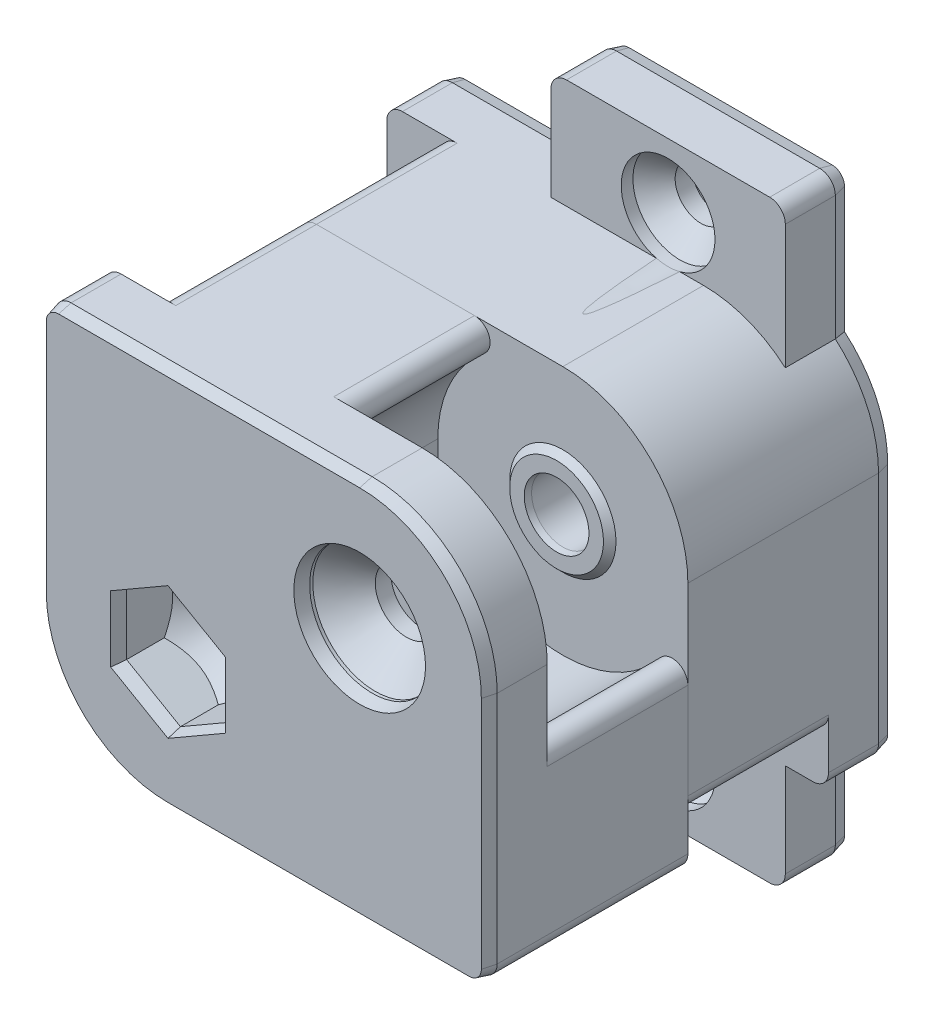
from build123d import *
from OCP.BRepFilletAPI import BRepFilletAPI_MakeChamfer

# Parameters (mm, degrees)
SKETCH1_R              = 2
EXTRUDE1_DEPTH         = 4
EXTRUDE2_START         = 4
EXTRUDE2_OUTLINE_R     = 2
EXTRUDE2_DEPTH         = 9
SKETCH2_W              = 3.5
SKETCH2_H              = 16
SKETCH2_W_2            = 12.265
SKETCH2_H_2            = 3.205245732
SKETCH2_W_3            = 8
SKETCH2_H_3            = 4.794754268
EXTRUDE3_DEPTH         = 9
SKETCH5_R              = 2
SKETCH5_W              = 12.265
SKETCH5_H              = 3.205245732
EXTRUDE4_DEPTH         = 9
SKETCH6_R              = 2
EXTRUDE5_DEPTH         = 4
FILLET1_START          = 12
FILLET1_DEPTH          = 10
FILLET1_START_2        = 21.15058
FILLET1_2_DEPTH        = 5.84942
FILLET2_R              = 1
SKETCH7_R              = 1.65
SKETCH7_W              = 15
SKETCH7_H              = 6.99475429
EXTRUDE6_DEPTH         = 4
SKETCH8_R              = 3
EXTRUDE7_DEPTH         = 14
EXTRUDE7_TAPER         = 1
SKETCH12_R             = 4
EXTRUDE15_DEPTH        = 1
SKETCH13_R             = 3
EXTRUDE16_DEPTH        = 0.6
SKETCH14_R             = 4.000000009
EXTRUDE17_DEPTH        = 1
CHAMFER1_START         = 3.25
CHAMFER1_2_OUTLINE_R   = 3
CHAMFER1_2_OUTLINE_R_2 = 1.65
CHAMFER1_2_DEPTH       = 0.15
CHAMFER7_SIZE          = 2
CHAMFER2_SIZE          = 2
SKETCH9_R              = 2
EXTRUDE8_DEPTH         = 3.2
EXTRUDE9_START         = -26
EXTRUDE9_DEPTH         = 3.2
CHAMFER4_START         = 3.2
CHAMFER4_2_OUTLINE_R   = 2
CHAMFER4_2_DEPTH       = 0.016283143
CHAMFER4_START_2       = 3.216283143
CHAMFER4_3_OUTLINE_W   = 11
CHAMFER4_3_OUTLINE_H   = 10
CHAMFER4_3_DEPTH       = 0.533716265
SKETCH10_R             = 2
EXTRUDE10_DEPTH        = 3
EXTRUDE10_TAPER        = 5
SKETCH_2_R             = 2
EXTRUDE11_DEPTH        = 3
EXTRUDE11_DRAFT        = -5
SKETCH_3_R             = 2
EXTRUDE13_DEPTH        = 3.2
EXTRUDE13_DRAFT        = -3
SKETCH_4_R             = 2
EXTRUDE14_DEPTH        = 3.2
EXTRUDE14_TAPER        = 3
FILLET3_R              = 1
CHAMFER5_SIZE          = 0.8
CHAMFER5_SIZE2         = 0.214359354
CHAMFER6_SIZE          = 0.8
CHAMFER6_SIZE2         = 0.214359354
SKETCH15_R             = 3
SKETCH15_R_2           = 2
EXTRUDE18_DEPTH        = 0.4
EXTRUDE18_DRAFT        = 10
SKETCH16_R             = 3
SKETCH16_R_2           = 2
EXTRUDE19_DEPTH        = 0.4
EXTRUDE19_DRAFT        = 10
SKETCH17_R             = 3
SKETCH17_R_2           = 2
EXTRUDE20_DEPTH        = 0.4
EXTRUDE20_DRAFT        = 10
SKETCH18_R             = 3
SKETCH18_R_2           = 2
EXTRUDE21_DEPTH        = 0.4
EXTRUDE21_DRAFT        = 10
CHAMFER9_SIZE          = 0.4
CHAMFER9_SIZE_2        = 0.493121221


with BuildPart() as part:
    # Sketch1 → Extrude1 (new body)
    with BuildSketch(Plane.XY):
        with BuildLine():
            ThreePointArc((14.686486952, 3.994754268), (12.343341202, 9.651608518), (6.686486952, 11.994754268))
            Line((6.686486952, 11.994754268), (-13.578513048, 11.994754268))
            Line((-13.578513048, 11.994754268), (-13.578513048, -4.005245732))
            ThreePointArc((-13.578513048, -4.005245732), (-11.235367297, -9.662099981), (-5.578513048, -12.005245732))
            Line((-5.578513048, -12.005245732), (14.686486952, -12.005245732))
            Line((14.686486952, -12.005245732), (14.686486952, 3.994754268))
        make_face()
        with Locations((-5.578513048, -4.005245732)):
            Circle(SKETCH1_R, mode=Mode.SUBTRACT)
        with Locations((6.686486952, 3.994754268)):
            Circle(SKETCH1_R, mode=Mode.SUBTRACT)
    extrude(amount=EXTRUDE1_DEPTH)

    # Extrude2: read off the stored shape, not the designer's step
    # Extrude2 outline → Extrude2 (add)
    with BuildSketch(Plane.XY.offset(EXTRUDE2_START)):
        with BuildLine():
            ThreePointArc((14.686486952, 3.994754268), (12.343341202, 9.651608518), (6.686486952, 11.994754268))
            Line((6.686486952, 11.994754268), (-13.578513048, 11.994754268))
            Line((-13.578513048, 11.994754268), (-13.578513048, -4.005245732))
            ThreePointArc((-13.578513048, -4.005245732), (0.078343907, 1.651605813), (-5.578520698, -12.005245732))
            Line((-5.578520698, -12.005245732), (14.686486952, -12.005245732))
            Line((14.686486952, -12.005245732), (14.686486952, 3.994754268))
        make_face()
        with Locations((6.686486952, 3.994754268)):
            Circle(EXTRUDE2_OUTLINE_R, mode=Mode.SUBTRACT)
    extrude(amount=EXTRUDE2_DEPTH)

    # Sketch2 → Extrude3 (cut)
    with BuildSketch(Plane.XY.offset(13)):
        with Locations((-11.828513048, 3.994754268)):
            Rectangle(SKETCH2_W, SKETCH2_H)
        with Locations((8.553986952, -10.402622866)):
            Rectangle(SKETCH2_W_2, SKETCH2_H_2)
        with Locations((-1.578513048, -10.402622866)):
            Rectangle(SKETCH2_W_3, SKETCH2_H_2)
        with Locations((-1.578513048, -6.402622866)):
            Rectangle(SKETCH2_W_3, SKETCH2_H_3)
    extrude(amount=-EXTRUDE3_DEPTH, mode=Mode.SUBTRACT)

    # Fillet2
    fillet2_edges = [part.edges().sort_by_distance(p)[0] for p in [
        (-10.078513048, 11.994754268, 8.5),
        (-13.578513048, 11.994754268, 2),
        (14.686486952, -8.8, 8.5),
        (14.686486952, -12.005245732, 2),
        (-10.078513048, 2.609132546, 8.5),
        (2.421486952, -8.8, 8.5),
    ]]
    fillet(fillet2_edges, radius=FILLET2_R)

    # Sketch7 → Extrude6 (add)
    # profile 1 of 2: a face of its own
    with BuildSketch(Plane(origin=(0, 0, 0), x_dir=(-1, 0, 0), z_dir=(0, 0, -1))):
        with BuildLine():
            Line((-11.921486952, 18.999999976), (-11.921486952, 10.044115805))
            ThreePointArc((-11.921486952, 10.044115805), (-9.479792137, 11.491249859), (-6.686486952, 11.994754268))
            Line((-6.686486952, 11.994754268), (3.078513048, 11.994754268))
            Line((3.078513048, 11.994754268), (3.078513048, 18.999999976))
            Line((3.078513048, 18.999999976), (-11.921486952, 18.999999976))
        make_face()
        with Locations((-4.421486952, 14.899999976)):
            Circle(SKETCH7_R, mode=Mode.SUBTRACT)
    # profile 2 of 2: a face of its own
    with BuildSketch(Plane(origin=(0, 0, 0), x_dir=(-1, 0, 0), z_dir=(0, 0, -1))):
        with Locations((-4.421486952, -15.502622877)):
            Rectangle(SKETCH7_W, SKETCH7_H)
        with Locations((-4.421486952, -14.900000022)):
            Circle(SKETCH7_R, mode=Mode.SUBTRACT)
    extrude(amount=-EXTRUDE6_DEPTH)

    # Sketch8 → Extrude7 (cut)
    with BuildSketch(Plane.XY.offset(4)):
        with Locations((4.421486952, 14.899999976)):
            Circle(SKETCH8_R)
    extrude(amount=EXTRUDE7_DEPTH, taper=EXTRUDE7_TAPER, mode=Mode.SUBTRACT)

    # Sketch13 → Extrude16 (cut)
    with BuildSketch(Plane.XY.offset(4)):
        with Locations((4.421486952, 14.899999976)):
            Circle(SKETCH13_R)
        with Locations((4.421486952, -14.900000022)):
            Circle(SKETCH13_R)
    extrude(amount=-EXTRUDE16_DEPTH, mode=Mode.SUBTRACT)

    # Sketch14 → Extrude17 (cut)
    with BuildSketch(Plane(origin=(0, 0, 0), x_dir=(-1, 0, 0), z_dir=(0, 0, -1))):
        with Locations((5.578513048, -4.005245732)):
            Circle(SKETCH14_R)
    extrude(amount=-EXTRUDE17_DEPTH, mode=Mode.SUBTRACT)

    # Chamfer1: read off the stored shape, not the designer's step
    # Chamfer1 outline → Chamfer1 (revolve, cut)
    with BuildSketch(Plane(origin=(4.421486952, 14.899999976, 0), x_dir=(1, 0, 0), z_dir=(0, -1, 0))):
        Polygon((1.65, 3.25), (1.65, 1.9), (3, 3.25), align=None)
    revolve(axis=Axis((4.421486952, 14.899999976, 0), (0, 0, 1)), mode=Mode.SUBTRACT)

    # Chamfer1 2 outline → Chamfer1 2 (cut)
    # profile 1 of 2: a face of its own
    with BuildSketch(Plane.XY.offset(CHAMFER1_START)):
        with Locations((4.421486952, 14.899999976)):
            Circle(CHAMFER1_2_OUTLINE_R)
        with Locations((4.421486952, 14.899999976)):
            Circle(CHAMFER1_2_OUTLINE_R_2, mode=Mode.SUBTRACT)
    # profile 2 of 2: a face of its own
    with BuildSketch(Plane.XY.offset(CHAMFER1_START)):
        with Locations((4.421486952, -14.900000022)):
            Circle(CHAMFER1_2_OUTLINE_R)
        with Locations((4.421486952, -14.900000022)):
            Circle(CHAMFER1_2_OUTLINE_R_2, mode=Mode.SUBTRACT)
    extrude(amount=CHAMFER1_2_DEPTH, mode=Mode.SUBTRACT)

    # Chamfer1 3 outline → Chamfer1 3 (revolve, cut)
    with BuildSketch(Plane(origin=(4.421486952, -14.900000022, 0), x_dir=(1, 0, 0), z_dir=(0, -1, 0))):
        Polygon((1.65, 3.25), (1.65, 1.9), (3, 3.25), align=None)
    revolve(axis=Axis((4.421486952, -14.900000022, 0), (0, 0, 1)), mode=Mode.SUBTRACT)

    # Chamfer7
    chamfer7_edges = [part.edges().sort_by_distance(p)[0] for p in [
        (-7.578513048, -4.005245732, 1),
    ]]
    chamfer(chamfer7_edges, length=CHAMFER7_SIZE - 0.0001)  # a hair under: the kernel refuses the full size

    # Sketch9 → Extrude8 (cut)
    with BuildSketch(Plane(origin=(0, 0, 0), x_dir=(-1, 0, 0), z_dir=(0, 0, -1))):
        Polygon((-3.236486952, 2.002895839), (-3.236486952, 5.986612697), (-6.686486952, 7.978471126), (-10.136486952, 5.986612697), (-10.136486952, 2.002895839), (-6.686486952, 0.011037411), align=None)
        with Locations(Location((-6.686486952, 3.994754268, 0), (0, 0, 180))):
            Circle(SKETCH9_R, mode=Mode.SUBTRACT)
    extrude(amount=-EXTRUDE8_DEPTH, mode=Mode.SUBTRACT)

    # Chamfer4: read off the stored shape, not the designer's step
    # Chamfer4 outline → Chamfer4 (revolve, cut)
    with BuildSketch(Plane(origin=(6.686486952, 3.994754268, 0), x_dir=(1, 0, 0), z_dir=(0, -1, 0))):
        Polygon((3.983716857, 3.216283143), (2, 5.2), (2, 3.216283143), align=None)
    revolve(axis=Axis((6.686486952, 3.994754268, 0), (0, 0, 1)), mode=Mode.SUBTRACT)

    # Chamfer4 2 outline → Chamfer4 2 (cut)
    with BuildSketch(Plane.XY.offset(CHAMFER4_START)):
        Polygon((6.686486952, 7.978471126), (3.236486952, 5.986612697), (3.236486952, 2.002895839), (6.686486952, 0.011037411), (10.136486952, 2.002895839), (10.136486952, 5.986612697), align=None)
        with Locations((6.686486952, 3.994754268)):
            Circle(CHAMFER4_2_OUTLINE_R, mode=Mode.SUBTRACT)
    extrude(amount=CHAMFER4_2_DEPTH, mode=Mode.SUBTRACT)

    # Chamfer4 3 outline → Chamfer4 3 (add)
    with BuildSketch(Plane.XY.offset(CHAMFER4_START_2)):
        with Locations((6.5, 4)):
            Rectangle(CHAMFER4_3_OUTLINE_W, CHAMFER4_3_OUTLINE_H)
        Polygon((3.236486952, 2.002895839), (3.236486952, 5.986612697), (6.686486952, 7.978471126), (10.136486952, 5.986612697), (10.136486952, 2.002895839), (6.686486952, 0.011037411), align=None, mode=Mode.SUBTRACT)
    extrude(amount=CHAMFER4_3_DEPTH)

    # Sketch10 → Extrude10 (add)
    with BuildSketch(Plane.XY.offset(13)):
        with Locations((-5.078513048, 7.994754268)):
            Circle(SKETCH10_R)
    extrude(amount=EXTRUDE10_DEPTH, taper=EXTRUDE10_TAPER)


with BuildPart() as body_2:
    # Sketch5 → Extrude4 (new body)
    # profile 1 of 4: a face of its own
    with BuildSketch(Plane.XY.offset(13)):
        with BuildLine():
            Line((6.686486952, 11.994754268), (-10.078513048, 11.994754268))
            Line((-10.078513048, 11.99475427), (-10.078513048, 2.609132546))
            ThreePointArc((-10.078513048, 2.609132546), (-5.71897158, 3.993521136), (-1.313513048, 2.76304615))
            Line((-1.313513048, 2.76304615), (-1.313513048, 3.994754268))
            ThreePointArc((-1.313513048, 3.994754268), (1.029632703, 9.651608518), (6.686486952, 11.994754268))
        make_face()
    # profile 2 of 4: a face of its own
    with BuildSketch(Plane.XY.offset(13)):
        with BuildLine():
            Line((2.421486952, -2.773537614), (2.421486952, -4.005245732))
            Line((2.421486952, -4.005245732), (2.421486952, -8.8))
            Line((2.421486952, -8.8), (14.686486952, -8.8))
            Line((14.686486952, -8.8), (14.686486952, 3.994754268))
            ThreePointArc((14.686486952, 3.994754268), (10.55171657, -3.009530135), (2.421486952, -2.773537614))
        make_face()
    # profile 3 of 4: a face of its own
    with BuildSketch(Plane.XY.offset(13)):
        with BuildLine():
            Line((-10.078513048, 2.609132546), (-10.078513048, -10.618400032))
            ThreePointArc((-10.078513048, -10.618400032), (-7.933809171, -11.648966623), (-5.580825931, -12.002932847))
            Line((-5.580825931, -12.002932847), (-1.313513048, -12.002932847))
            Line((-1.313513048, -12.002932847), (-1.313513048, 2.76304615))
            ThreePointArc((-1.313513048, 2.76304615), (-5.71897158, 3.993521136), (-10.078513048, 2.609132546))
        make_face()
        with Locations((-5.580825931, -4.00524573)):
            Circle(SKETCH5_R, mode=Mode.SUBTRACT)
    # profile 4 of 4: a face of its own
    with BuildSketch(Plane.XY.offset(13)):
        with Locations((8.553986952, -10.402622866)):
            Rectangle(SKETCH5_W, SKETCH5_H)
    extrude(amount=EXTRUDE4_DEPTH)

    # Sketch6 → Extrude5 (add)
    with BuildSketch(Plane.XY.offset(22)):
        with BuildLine():
            Line((-13.578513048, 11.994754268), (-13.578513048, -4.005245732))
            ThreePointArc((-13.578513048, -4.005245732), (-11.235370002, -9.662097276), (-5.578520698, -12.005245732))
            Line((-5.578520698, -12.005245732), (14.686486952, -12.005245732))
            Line((14.686486952, -12.005245732), (14.686486952, 3.994754268))
            ThreePointArc((14.686486952, 3.994754268), (12.343341202, 9.651608518), (6.686486952, 11.994754268))
            Line((6.686486952, 11.994754268), (-13.578513048, 11.994754268))
        make_face()
        with Locations((6.686486952, 3.994754268)):
            Circle(SKETCH6_R, mode=Mode.SUBTRACT)
        with Locations(Location((-5.578513048, -4.005245732, 0), (0, 0, 269.966834307))):
            Circle(SKETCH6_R, mode=Mode.SUBTRACT)
    extrude(amount=EXTRUDE5_DEPTH)

    # Fillet1: read off the stored shape, not the designer's step
    # Fillet1 outline → Fillet1 (cut)
    with BuildSketch(Plane.XY.offset(FILLET1_START)):
        with BuildLine():
            ThreePointArc((3.421486952, -12.005245732), (2.714380171, -11.712352513), (2.421486952, -11.005245732))
            Line((2.421486952, -11.005245732), (2.421486952, -12.005245732))
            Line((2.421486952, -12.005245732), (3.421486952, -12.005245732))
        make_face()
        with BuildLine():
            Line((2.421486952, -2.773537614), (2.421486952, -4.392126857))
            ThreePointArc((2.421486952, -4.392126857), (2.857030478, -3.566664023), (3.78426473, -3.460251176))
            ThreePointArc((3.78426473, -3.460251176), (3.086464386, -3.149462801), (2.421486952, -2.773537614))
        make_face()
        with BuildLine():
            ThreePointArc((14.686486952, -11.005245732), (14.393593733, -11.712352514), (13.686486952, -12.005245732))
            Line((13.686486952, -12.005245732), (14.686486952, -12.005245732))
            Line((14.686486952, -12.005245732), (14.686486952, -11.005245732))
        make_face()
        with BuildLine():
            ThreePointArc((14.686486952, 3.994754268), (14.228959285, 1.328087602), (12.908709175, -1.03356062))
            ThreePointArc((12.908709175, -1.03356062), (14.019820286, -0.71929094), (14.686486952, -1.662099981))
            Line((14.686486952, -1.662099981), (14.686486952, 3.994754268))
        make_face()
        with BuildLine():
            Line((-9.078513048, 11.994754268), (-10.078513048, 11.994754268))
            Line((-10.078513048, 11.994754268), (-10.078513048, 10.994754268))
            ThreePointArc((-10.078513048, 10.994754268), (-9.785619829, 11.701861049), (-9.078513048, 11.994754268))
        make_face()
        with BuildLine():
            Line((6.686486952, 11.994754268), (1.029632703, 11.994754268))
            ThreePointArc((1.029632703, 11.994754268), (1.972441745, 11.328087601), (1.658172064, 10.21697649))
            ThreePointArc((1.658172064, 10.21697649), (4.019820285, 11.537226601), (6.686486952, 11.994754268))
        make_face()
        with BuildLine():
            ThreePointArc((-9.578347787, -10.932208862), (-9.944490743, -10.566170689), (-10.078513048, -10.066088066))
            Line((-10.078513048, -10.066088066), (-10.078513048, -10.618400032))
            ThreePointArc((-10.078513048, -10.618400032), (-9.831327415, -10.779921837), (-9.578347787, -10.932208862))
        make_face()
        with BuildLine():
            Line((-1.313513048, -12.002932847), (-1.313513048, -11.002932847))
            ThreePointArc((-1.313513048, -11.002932847), (-1.606406266, -11.710039629), (-2.313513048, -12.002932847))
            Line((-2.313513048, -12.002932847), (-1.313513048, -12.002932847))
        make_face()
    extrude(amount=FILLET1_DEPTH, mode=Mode.SUBTRACT)

    # Fillet1 2 outline → Fillet1 2 (cut)
    with BuildSketch(Plane.XY.offset(FILLET1_START_2)):
        with BuildLine():
            ThreePointArc((14.686486952, -11.005245732), (14.393593733, -11.712352514), (13.686486952, -12.005245732))
            Line((13.686486952, -12.005245732), (14.686486952, -12.005245732))
            Line((14.686486952, -12.005245732), (14.686486952, -11.005245732))
        make_face()
        with BuildLine():
            Line((-13.578513048, 11.994754268), (-13.578513048, 10.994754268))
            ThreePointArc((-13.578513048, 10.994754268), (-13.285619829, 11.701861049), (-12.578513048, 11.994754268))
            Line((-12.578513048, 11.994754268), (-13.578513048, 11.994754268))
        make_face()
    extrude(amount=FILLET1_2_DEPTH, mode=Mode.SUBTRACT)

    # Sketch12 → Extrude15 (cut)
    with BuildSketch(Plane.XY.offset(26)):
        with Locations((6.686486952, 3.994754268)):
            Circle(SKETCH12_R)
    extrude(amount=-EXTRUDE15_DEPTH, mode=Mode.SUBTRACT)

    # Chamfer2
    chamfer2_edges = [body_2.edges().sort_by_distance(p)[0] for p in [
        (4.686486952, 3.994754268, 25),
    ]]
    chamfer(chamfer2_edges, length=CHAMFER2_SIZE - 0.0001)  # a hair under: the kernel refuses the full size

    # Sketch → Extrude9 (cut)
    with BuildSketch(Plane(origin=(0, 0, 0), x_dir=(-1, 0, 0), z_dir=(0, 0, -1)).offset(EXTRUDE9_START)):
        Polygon((5.578513048, -0.021528874), (2.128513048, -2.013387303), (2.128513048, -5.997104161), (5.578513048, -7.988962589), (9.028513048, -5.997104161), (9.028513048, -2.013387303), align=None)
    extrude(amount=EXTRUDE9_DEPTH, mode=Mode.SUBTRACT)

    # Chamfer3
    # the kernel refuses this chamfer: 2 mm, written as the material it takes off along each edge
    with BuildSketch(Plane(origin=(-5.578513048, -4.005245732, 22.8), x_dir=(-0.000578850509229678, -0.99999983246603, 0), z_dir=(0.99999983246603, -0.000578850509229678, 0))) as chamfer3_piece_1_section:
        with BuildLine():
            Line((4.056568542, -0.056568542), (1.943431458, 2.056568542))
            Line((1.943431458, 2.056568542), (1.903431458, 2.056568542))
            ThreePointArc((1.903431458, 2.056568542), (1.96, 1.028284271), (1.96, 0))
            Line((1.96, 0), (2, -0.04))
            ThreePointArc((2, -0.04), (3.028284271, -0.04), (4.056568542, -0.096568542))
            Line((4.056568542, -0.096568542), (4.056568542, -0.056568542))
        make_face()
    chamfer3_piece_1 = revolve(axis=Axis((-5.578513048, -4.005245732, 22.8), (0, 0, -1)), mode=Mode.PRIVATE)
    chamfer3_piece_1 = split(chamfer3_piece_1, bisect_by=Plane(origin=(-7.303513048, -1.017458089, 22.8), z_dir=(0.49999999999999956, -0.8660254037844389, 0)), keep=Keep.TOP, mode=Mode.PRIVATE)
    chamfer3_piece_1 = split(chamfer3_piece_1, bisect_by=Plane(origin=(-9.028513048, -4.005245732, 22.8), z_dir=(1, 0, 0)), keep=Keep.TOP, mode=Mode.PRIVATE)
    chamfer3_piece_1 = split(chamfer3_piece_1, bisect_by=Plane(origin=(-7.303513048, -6.993033375, 22.8), z_dir=(0.5000000000000006, 0.8660254037844384, 0)), keep=Keep.TOP, mode=Mode.PRIVATE)
    chamfer3_piece_1 = split(chamfer3_piece_1, bisect_by=Plane(origin=(-3.853513048, -6.993033375, 22.8), z_dir=(-0.4999999999999996, 0.8660254037844389, 0)), keep=Keep.TOP, mode=Mode.PRIVATE)
    chamfer3_piece_1 = split(chamfer3_piece_1, bisect_by=Plane(origin=(-2.128513048, -4.005245732, 22.8), z_dir=(-1, 0, 0)), keep=Keep.TOP, mode=Mode.PRIVATE)
    chamfer3_piece_1 = split(chamfer3_piece_1, bisect_by=Plane(origin=(-3.853513048, -1.017458089, 22.8), z_dir=(-0.5000000000000002, -0.8660254037844386, 0)), keep=Keep.TOP, mode=Mode.PRIVATE)
    add(chamfer3_piece_1, mode=Mode.SUBTRACT)


with BuildPart() as extrude11_tool:
    # Sketch 2 → Extrude11 (with draft: the straight prism first)
    with BuildSketch(Plane.XY.offset(13)):
        with Locations((11.686486952, -5.8)):
            Circle(SKETCH_2_R)
    extrude(amount=-EXTRUDE11_DEPTH)
    # Extrude11: the draft: its side faces are tilted about the plane it starts from
    extrude11_sides = [extrude11_tool.faces().sort_by_distance(p)[0] for p in [
        (9.686486952, -5.8, 11.5),
    ]]
    draft(extrude11_sides, Plane.XY.offset(13), EXTRUDE11_DRAFT)


with BuildPart() as body_2_1:
    add(body_2.part)

    # Extrude11: add extrude11_tool
    add(extrude11_tool.part)

    # Sketch 4 → Extrude14 (cut)
    with BuildSketch(Plane.XY.offset(13)):
        with Locations((-5.078513048, 7.994754268)):
            Circle(SKETCH_4_R)
    extrude(amount=EXTRUDE14_DEPTH, taper=EXTRUDE14_TAPER, mode=Mode.SUBTRACT)

    # Chamfer5: one chamfer whose edges measure the first distance from different faces: ONE call of the kernel's chamfer builder (chamfer() names one face for all edges)
    chamfer5_edges_1 = [body_2_1.edges().sort_by_distance(p)[0] for p in [
        (2.686486952, 3.994754268, 26),
    ]]
    chamfer5_side_1 = [body_2_1.faces().sort_by_distance(p)[0] for p in [
        (2.686486952, 3.994754268, 25.5),
    ]]
    chamfer5_edges_2 = [body_2_1.edges().sort_by_distance(p)[0] for p in [
        (-7.303513048, -1.017458089, 26),
    ]]
    chamfer5_side_2 = [body_2_1.faces().sort_by_distance(p)[0] for p in [
        (-7.303513048, -1.017458089, 24.212915895),
    ]]
    chamfer5_edges_3 = [body_2_1.edges().sort_by_distance(p)[0] for p in [
        (-3.853513048, -1.017458089, 26),
    ]]
    chamfer5_side_3 = [body_2_1.faces().sort_by_distance(p)[0] for p in [
        (-3.853513048, -1.017458089, 24.212915895),
    ]]
    chamfer5_edges_4 = [body_2_1.edges().sort_by_distance(p)[0] for p in [
        (-2.128513048, -4.005245732, 26),
    ]]
    chamfer5_side_4 = [body_2_1.faces().sort_by_distance(p)[0] for p in [
        (-2.128513048, -4.005245732, 24.212915895),
    ]]
    chamfer5_edges_5 = [body_2_1.edges().sort_by_distance(p)[0] for p in [
        (-3.853513048, -6.993033375, 26),
    ]]
    chamfer5_side_5 = [body_2_1.faces().sort_by_distance(p)[0] for p in [
        (-3.853513048, -6.993033375, 24.212915895),
    ]]
    chamfer5_edges_6 = [body_2_1.edges().sort_by_distance(p)[0] for p in [
        (-7.303513048, -6.993033375, 26),
    ]]
    chamfer5_side_6 = [body_2_1.faces().sort_by_distance(p)[0] for p in [
        (-7.303513048, -6.993033375, 24.212915895),
    ]]
    chamfer5_edges_7 = [body_2_1.edges().sort_by_distance(p)[0] for p in [
        (-9.028513048, -4.005245732, 26),
    ]]
    chamfer5_side_7 = [body_2_1.faces().sort_by_distance(p)[0] for p in [
        (-9.028513048, -4.005245732, 24.212915895),
    ]]
    chamfer5_edges_8 = [body_2_1.edges().sort_by_distance(p)[0] for p in [
        (-11.235370002, -9.662097276, 26),
    ]]
    chamfer5_side_8 = [body_2_1.faces().sort_by_distance(p)[0] for p in [
        (-11.235370002, -9.662097276, 24),
    ]]
    chamfer5_edges_9 = [body_2_1.edges().sort_by_distance(p)[0] for p in [
        (4.053983127, -12.005245732, 26),
    ]]
    chamfer5_side_9 = [body_2_1.faces().sort_by_distance(p)[0] for p in [
        (6.507480004, -12.005245732, 20.456063079),
    ]]
    chamfer5_edges_10 = [body_2_1.edges().sort_by_distance(p)[0] for p in [
        (12.343341202, 9.651608518, 26),
    ]]
    chamfer5_side_10 = [body_2_1.faces().sort_by_distance(p)[0] for p in [
        (12.343341202, 9.651608518, 24),
    ]]
    chamfer5_edges_11 = [body_2_1.edges().sort_by_distance(p)[0] for p in [
        (-2.946013048, 11.994754268, 26),
    ]]
    chamfer5_side_11 = [body_2_1.faces().sort_by_distance(p)[0] for p in [
        (-3.529873986, 11.994754268, 20.48089703),
    ]]
    chamfer5_edges_12 = [body_2_1.edges().sort_by_distance(p)[0] for p in [
        (14.686486952, -3.505245732, 26),
    ]]
    chamfer5_side_12 = [body_2_1.faces().sort_by_distance(p)[0] for p in [
        (14.686486952, -5.155883864, 20.206673395),
    ]]
    chamfer5_edges_13 = [body_2_1.edges().sort_by_distance(p)[0] for p in [
        (-13.578513048, 3.494754268, 26),
    ]]
    chamfer5_side_13 = [body_2_1.faces().sort_by_distance(p)[0] for p in [
        (-13.578513048, 3.494754268, 24),
    ]]
    chamfer5_edges_14 = [body_2_1.edges().sort_by_distance(p)[0] for p in [
        (-13.285619829, 11.701861049, 26),
    ]]
    chamfer5_side_14 = [body_2_1.faces().sort_by_distance(p)[0] for p in [
        (-13.285619829, 11.701861049, 24),
    ]]
    chamfer5_edges_15 = [body_2_1.edges().sort_by_distance(p)[0] for p in [
        (14.393593733, -11.712352514, 26),
    ]]
    chamfer5_side_15 = [body_2_1.faces().sort_by_distance(p)[0] for p in [
        (14.393593733, -11.712352514, 19.5),
    ]]
    chamfer5 = BRepFilletAPI_MakeChamfer(body_2_1.part.solid().wrapped)
    for e in chamfer5_edges_1:
        chamfer5.Add(CHAMFER5_SIZE, CHAMFER5_SIZE2, e.wrapped, chamfer5_side_1[0].wrapped)  # the first distance lies on this face
    for e in chamfer5_edges_2:
        chamfer5.Add(CHAMFER5_SIZE, CHAMFER5_SIZE2, e.wrapped, chamfer5_side_2[0].wrapped)  # the first distance lies on this face
    for e in chamfer5_edges_3:
        chamfer5.Add(CHAMFER5_SIZE, CHAMFER5_SIZE2, e.wrapped, chamfer5_side_3[0].wrapped)  # the first distance lies on this face
    for e in chamfer5_edges_4:
        chamfer5.Add(CHAMFER5_SIZE, CHAMFER5_SIZE2, e.wrapped, chamfer5_side_4[0].wrapped)  # the first distance lies on this face
    for e in chamfer5_edges_5:
        chamfer5.Add(CHAMFER5_SIZE, CHAMFER5_SIZE2, e.wrapped, chamfer5_side_5[0].wrapped)  # the first distance lies on this face
    for e in chamfer5_edges_6:
        chamfer5.Add(CHAMFER5_SIZE, CHAMFER5_SIZE2, e.wrapped, chamfer5_side_6[0].wrapped)  # the first distance lies on this face
    for e in chamfer5_edges_7:
        chamfer5.Add(CHAMFER5_SIZE, CHAMFER5_SIZE2, e.wrapped, chamfer5_side_7[0].wrapped)  # the first distance lies on this face
    for e in chamfer5_edges_8:
        chamfer5.Add(CHAMFER5_SIZE, CHAMFER5_SIZE2, e.wrapped, chamfer5_side_8[0].wrapped)  # the first distance lies on this face
    for e in chamfer5_edges_9:
        chamfer5.Add(CHAMFER5_SIZE, CHAMFER5_SIZE2, e.wrapped, chamfer5_side_9[0].wrapped)  # the first distance lies on this face
    for e in chamfer5_edges_10:
        chamfer5.Add(CHAMFER5_SIZE, CHAMFER5_SIZE2, e.wrapped, chamfer5_side_10[0].wrapped)  # the first distance lies on this face
    for e in chamfer5_edges_11:
        chamfer5.Add(CHAMFER5_SIZE, CHAMFER5_SIZE2, e.wrapped, chamfer5_side_11[0].wrapped)  # the first distance lies on this face
    for e in chamfer5_edges_12:
        chamfer5.Add(CHAMFER5_SIZE, CHAMFER5_SIZE2, e.wrapped, chamfer5_side_12[0].wrapped)  # the first distance lies on this face
    for e in chamfer5_edges_13:
        chamfer5.Add(CHAMFER5_SIZE, CHAMFER5_SIZE2, e.wrapped, chamfer5_side_13[0].wrapped)  # the first distance lies on this face
    for e in chamfer5_edges_14:
        chamfer5.Add(CHAMFER5_SIZE, CHAMFER5_SIZE2, e.wrapped, chamfer5_side_14[0].wrapped)  # the first distance lies on this face
    for e in chamfer5_edges_15:
        chamfer5.Add(CHAMFER5_SIZE, CHAMFER5_SIZE2, e.wrapped, chamfer5_side_15[0].wrapped)  # the first distance lies on this face
    add(Compound.cast(chamfer5.Shape()), mode=Mode.REPLACE)


with BuildPart() as extrude13_tool:
    # Sketch 3 → Extrude13 (with draft: the straight prism first)
    with BuildSketch(Plane.XY.offset(13)):
        with Locations((11.686486952, -5.8)):
            Circle(SKETCH_3_R)
    extrude(amount=-EXTRUDE13_DEPTH)
    # Extrude13: the draft: its side faces are tilted about the plane it starts from
    extrude13_sides = [extrude13_tool.faces().sort_by_distance(p)[0] for p in [
        (9.686486952, -5.8, 11.4),
    ]]
    draft(extrude13_sides, Plane.XY.offset(13), EXTRUDE13_DRAFT)


with BuildPart() as part_1:
    add(part.part)

    # Extrude13: cut by extrude13_tool
    add(extrude13_tool.part, mode=Mode.SUBTRACT)

    # Fillet3
    fillet3_edges = [part_1.edges().sort_by_distance(p)[0] for p in [
        (-3.078513048, -19.000000022, 2),
        (11.921486952, -19.000000022, 2),
        (-3.078513048, 18.999999976, 2),
        (11.921486952, 18.999999976, 2),
    ]]
    fillet(fillet3_edges, radius=FILLET3_R)

    # Chamfer6: one chamfer whose edges measure the first distance from different faces: ONE call of the kernel's chamfer builder (chamfer() names one face for all edges)
    chamfer6_edges_1 = [part_1.edges().sort_by_distance(p)[0] for p in [
        (14.393593734, -11.712352513, 0),
    ]]
    chamfer6_side_1 = [part_1.faces().sort_by_distance(p)[0] for p in [
        (14.393593734, -11.712352513, 2),
    ]]
    chamfer6_edges_2 = [part_1.edges().sort_by_distance(p)[0] for p in [
        (-13.285619829, 11.701861049, 0),
    ]]
    chamfer6_side_2 = [part_1.faces().sort_by_distance(p)[0] for p in [
        (-13.285619829, 11.701861049, 2),
    ]]
    chamfer6_edges_3 = [part_1.edges().sort_by_distance(p)[0] for p in [
        (14.686486952, -3.505245732, 0),
    ]]
    chamfer6_side_3 = [part_1.faces().sort_by_distance(p)[0] for p in [
        (14.686486952, -2.481351474, 6.152762835),
    ]]
    chamfer6_edges_4 = [part_1.edges().sort_by_distance(p)[0] for p in [
        (-4.328513048, -12.005245732, 0),
    ]]
    chamfer6_side_4 = [part_1.faces().sort_by_distance(p)[0] for p in [
        (-4.328513048, -12.005245732, 2),
    ]]
    chamfer6_edges_5 = [part_1.edges().sort_by_distance(p)[0] for p in [
        (-1.578513039, -4.005245732, 0),
        (-1.578513039, -4.005245732, 0),
    ]]
    chamfer6_side_5 = [part_1.faces().sort_by_distance(p)[0] for p in [
        (-1.578513039, -4.005245732, 0.5),
    ]]
    chamfer6_edges_6 = [part_1.edges().sort_by_distance(p)[0] for p in [
        (-13.578513048, 3.494754268, 0),
    ]]
    chamfer6_side_6 = [part_1.faces().sort_by_distance(p)[0] for p in [
        (-13.578513048, 3.494754268, 2),
    ]]
    chamfer6_edges_7 = [part_1.edges().sort_by_distance(p)[0] for p in [
        (13.962474858, 7.320412098, 0),
    ]]
    chamfer6_side_7 = [part_1.faces().sort_by_distance(p)[0] for p in [
        (13.962474858, 7.320412098, 2),
    ]]
    chamfer6_edges_8 = [part_1.edges().sort_by_distance(p)[0] for p in [
        (-7.828513048, 11.994754268, 0),
    ]]
    chamfer6_side_8 = [part_1.faces().sort_by_distance(p)[0] for p in [
        (-2.800753052, 11.994754268, 7.160239048),
    ]]
    chamfer6_edges_9 = [part_1.edges().sort_by_distance(p)[0] for p in [
        (11.921486952, 14.022057891, 0),
    ]]
    chamfer6_side_9 = [part_1.faces().sort_by_distance(p)[0] for p in [
        (11.921486952, 14.022057891, 2),
    ]]
    chamfer6_edges_10 = [part_1.edges().sort_by_distance(p)[0] for p in [
        (6.071486952, 14.899999976, 0),
    ]]
    chamfer6_side_10 = [part_1.faces().sort_by_distance(p)[0] for p in [
        (6.071486952, 14.899999976, 0.95),
    ]]
    chamfer6_edges_11 = [part_1.edges().sort_by_distance(p)[0] for p in [
        (-3.078513048, 14.997377122, 0),
    ]]
    chamfer6_side_11 = [part_1.faces().sort_by_distance(p)[0] for p in [
        (-3.078513048, 14.997377122, 2),
    ]]
    chamfer6_edges_12 = [part_1.edges().sort_by_distance(p)[0] for p in [
        (12.803986952, -12.005245732, 0),
    ]]
    chamfer6_side_12 = [part_1.faces().sort_by_distance(p)[0] for p in [
        (12.803986952, -12.005245732, 2),
    ]]
    chamfer6_edges_13 = [part_1.edges().sort_by_distance(p)[0] for p in [
        (6.071486952, -14.900000022, 0),
    ]]
    chamfer6_side_13 = [part_1.faces().sort_by_distance(p)[0] for p in [
        (6.071486952, -14.900000022, 0.95),
    ]]
    chamfer6_edges_14 = [part_1.edges().sort_by_distance(p)[0] for p in [
        (3.236486952, 3.994754268, 0),
    ]]
    chamfer6_side_14 = [part_1.faces().sort_by_distance(p)[0] for p in [
        (3.236486952, 3.994754268, 1.787084105),
    ]]
    chamfer6_edges_15 = [part_1.edges().sort_by_distance(p)[0] for p in [
        (4.961486952, 6.982541911, 0),
    ]]
    chamfer6_side_15 = [part_1.faces().sort_by_distance(p)[0] for p in [
        (4.961486952, 6.982541911, 1.6),
    ]]
    chamfer6_edges_16 = [part_1.edges().sort_by_distance(p)[0] for p in [
        (8.411486952, 6.982541911, 0),
    ]]
    chamfer6_side_16 = [part_1.faces().sort_by_distance(p)[0] for p in [
        (8.411486952, 6.982541911, 1.6),
    ]]
    chamfer6_edges_17 = [part_1.edges().sort_by_distance(p)[0] for p in [
        (10.136486952, 3.994754268, 0),
    ]]
    chamfer6_side_17 = [part_1.faces().sort_by_distance(p)[0] for p in [
        (10.136486952, 3.994754268, 1.787084105),
    ]]
    chamfer6_edges_18 = [part_1.edges().sort_by_distance(p)[0] for p in [
        (8.411486952, 1.006966625, 0),
    ]]
    chamfer6_side_18 = [part_1.faces().sort_by_distance(p)[0] for p in [
        (8.411486952, 1.006966625, 1.6),
    ]]
    chamfer6_edges_19 = [part_1.edges().sort_by_distance(p)[0] for p in [
        (4.961486952, 1.006966625, 0),
    ]]
    chamfer6_side_19 = [part_1.faces().sort_by_distance(p)[0] for p in [
        (4.961486952, 1.006966625, 1.6),
    ]]
    chamfer6_edges_20 = [part_1.edges().sort_by_distance(p)[0] for p in [
        (4.421486952, -19.000000022, 0),
    ]]
    chamfer6_side_20 = [part_1.faces().sort_by_distance(p)[0] for p in [
        (4.421486952, -19.000000022, 2),
    ]]
    chamfer6_edges_21 = [part_1.edges().sort_by_distance(p)[0] for p in [
        (4.421486952, 18.999999976, 0),
    ]]
    chamfer6_side_21 = [part_1.faces().sort_by_distance(p)[0] for p in [
        (4.421486952, 18.999999976, 2),
    ]]
    chamfer6_edges_22 = [part_1.edges().sort_by_distance(p)[0] for p in [
        (11.921486952, -15.002622877, 0),
    ]]
    chamfer6_side_22 = [part_1.faces().sort_by_distance(p)[0] for p in [
        (11.921486952, -15.002622877, 2),
    ]]
    chamfer6_edges_23 = [part_1.edges().sort_by_distance(p)[0] for p in [
        (-3.078513048, -15.002622877, 0),
    ]]
    chamfer6_side_23 = [part_1.faces().sort_by_distance(p)[0] for p in [
        (-3.078513048, -15.002622877, 2),
    ]]
    chamfer6_edges_24 = [part_1.edges().sort_by_distance(p)[0] for p in [
        (11.628593734, 18.707106758, 0),
    ]]
    chamfer6_side_24 = [part_1.faces().sort_by_distance(p)[0] for p in [
        (11.628593734, 18.707106758, 2),
    ]]
    chamfer6_edges_25 = [part_1.edges().sort_by_distance(p)[0] for p in [
        (-2.785619829, 18.707106758, 0),
    ]]
    chamfer6_side_25 = [part_1.faces().sort_by_distance(p)[0] for p in [
        (-2.785619829, 18.707106758, 2),
    ]]
    chamfer6_edges_26 = [part_1.edges().sort_by_distance(p)[0] for p in [
        (11.628593734, -18.707106803, 0),
    ]]
    chamfer6_side_26 = [part_1.faces().sort_by_distance(p)[0] for p in [
        (11.628593734, -18.707106803, 2),
    ]]
    chamfer6_edges_27 = [part_1.edges().sort_by_distance(p)[0] for p in [
        (-2.785619829, -18.707106803, 0),
    ]]
    chamfer6_side_27 = [part_1.faces().sort_by_distance(p)[0] for p in [
        (-2.785619829, -18.707106803, 2),
    ]]
    chamfer6 = BRepFilletAPI_MakeChamfer(part_1.part.solid().wrapped)
    for e in chamfer6_edges_1:
        chamfer6.Add(CHAMFER6_SIZE, CHAMFER6_SIZE2, e.wrapped, chamfer6_side_1[0].wrapped)  # the first distance lies on this face
    for e in chamfer6_edges_2:
        chamfer6.Add(CHAMFER6_SIZE, CHAMFER6_SIZE2, e.wrapped, chamfer6_side_2[0].wrapped)  # the first distance lies on this face
    for e in chamfer6_edges_3:
        chamfer6.Add(CHAMFER6_SIZE, CHAMFER6_SIZE2, e.wrapped, chamfer6_side_3[0].wrapped)  # the first distance lies on this face
    for e in chamfer6_edges_4:
        chamfer6.Add(CHAMFER6_SIZE, CHAMFER6_SIZE2, e.wrapped, chamfer6_side_4[0].wrapped)  # the first distance lies on this face
    for e in chamfer6_edges_5:
        chamfer6.Add(CHAMFER6_SIZE, CHAMFER6_SIZE2, e.wrapped, chamfer6_side_5[0].wrapped)  # the first distance lies on this face
    for e in chamfer6_edges_6:
        chamfer6.Add(CHAMFER6_SIZE, CHAMFER6_SIZE2, e.wrapped, chamfer6_side_6[0].wrapped)  # the first distance lies on this face
    for e in chamfer6_edges_7:
        chamfer6.Add(CHAMFER6_SIZE, CHAMFER6_SIZE2, e.wrapped, chamfer6_side_7[0].wrapped)  # the first distance lies on this face
    for e in chamfer6_edges_8:
        chamfer6.Add(CHAMFER6_SIZE, CHAMFER6_SIZE2, e.wrapped, chamfer6_side_8[0].wrapped)  # the first distance lies on this face
    for e in chamfer6_edges_9:
        chamfer6.Add(CHAMFER6_SIZE, CHAMFER6_SIZE2, e.wrapped, chamfer6_side_9[0].wrapped)  # the first distance lies on this face
    for e in chamfer6_edges_10:
        chamfer6.Add(CHAMFER6_SIZE, CHAMFER6_SIZE2, e.wrapped, chamfer6_side_10[0].wrapped)  # the first distance lies on this face
    for e in chamfer6_edges_11:
        chamfer6.Add(CHAMFER6_SIZE, CHAMFER6_SIZE2, e.wrapped, chamfer6_side_11[0].wrapped)  # the first distance lies on this face
    for e in chamfer6_edges_12:
        chamfer6.Add(CHAMFER6_SIZE, CHAMFER6_SIZE2, e.wrapped, chamfer6_side_12[0].wrapped)  # the first distance lies on this face
    for e in chamfer6_edges_13:
        chamfer6.Add(CHAMFER6_SIZE, CHAMFER6_SIZE2, e.wrapped, chamfer6_side_13[0].wrapped)  # the first distance lies on this face
    for e in chamfer6_edges_14:
        chamfer6.Add(CHAMFER6_SIZE, CHAMFER6_SIZE2, e.wrapped, chamfer6_side_14[0].wrapped)  # the first distance lies on this face
    for e in chamfer6_edges_15:
        chamfer6.Add(CHAMFER6_SIZE, CHAMFER6_SIZE2, e.wrapped, chamfer6_side_15[0].wrapped)  # the first distance lies on this face
    for e in chamfer6_edges_16:
        chamfer6.Add(CHAMFER6_SIZE, CHAMFER6_SIZE2, e.wrapped, chamfer6_side_16[0].wrapped)  # the first distance lies on this face
    for e in chamfer6_edges_17:
        chamfer6.Add(CHAMFER6_SIZE, CHAMFER6_SIZE2, e.wrapped, chamfer6_side_17[0].wrapped)  # the first distance lies on this face
    for e in chamfer6_edges_18:
        chamfer6.Add(CHAMFER6_SIZE, CHAMFER6_SIZE2, e.wrapped, chamfer6_side_18[0].wrapped)  # the first distance lies on this face
    for e in chamfer6_edges_19:
        chamfer6.Add(CHAMFER6_SIZE, CHAMFER6_SIZE2, e.wrapped, chamfer6_side_19[0].wrapped)  # the first distance lies on this face
    for e in chamfer6_edges_20:
        chamfer6.Add(CHAMFER6_SIZE, CHAMFER6_SIZE2, e.wrapped, chamfer6_side_20[0].wrapped)  # the first distance lies on this face
    for e in chamfer6_edges_21:
        chamfer6.Add(CHAMFER6_SIZE, CHAMFER6_SIZE2, e.wrapped, chamfer6_side_21[0].wrapped)  # the first distance lies on this face
    for e in chamfer6_edges_22:
        chamfer6.Add(CHAMFER6_SIZE, CHAMFER6_SIZE2, e.wrapped, chamfer6_side_22[0].wrapped)  # the first distance lies on this face
    for e in chamfer6_edges_23:
        chamfer6.Add(CHAMFER6_SIZE, CHAMFER6_SIZE2, e.wrapped, chamfer6_side_23[0].wrapped)  # the first distance lies on this face
    for e in chamfer6_edges_24:
        chamfer6.Add(CHAMFER6_SIZE, CHAMFER6_SIZE2, e.wrapped, chamfer6_side_24[0].wrapped)  # the first distance lies on this face
    for e in chamfer6_edges_25:
        chamfer6.Add(CHAMFER6_SIZE, CHAMFER6_SIZE2, e.wrapped, chamfer6_side_25[0].wrapped)  # the first distance lies on this face
    for e in chamfer6_edges_26:
        chamfer6.Add(CHAMFER6_SIZE, CHAMFER6_SIZE2, e.wrapped, chamfer6_side_26[0].wrapped)  # the first distance lies on this face
    for e in chamfer6_edges_27:
        chamfer6.Add(CHAMFER6_SIZE, CHAMFER6_SIZE2, e.wrapped, chamfer6_side_27[0].wrapped)  # the first distance lies on this face
    add(Compound.cast(chamfer6.Shape()), mode=Mode.REPLACE)


with BuildPart() as extrude18_tool:
    # Sketch15 → Extrude18 (with draft: the straight prism first)
    with BuildSketch(Plane.XY.offset(4)):
        with Locations((-5.578513048, -4.005245732)):
            Circle(SKETCH15_R)
        with Locations(Location((-5.578513048, -4.005245732, 0), (0, 0, 180))):
            Circle(SKETCH15_R_2, mode=Mode.SUBTRACT)
    extrude(amount=EXTRUDE18_DEPTH)
    # Extrude18: the draft: its side faces are tilted about the plane it starts from
    extrude18_sides = [extrude18_tool.faces().sort_by_distance(p)[0] for p in [
        (-8.578513048, -4.005245732, 4.2),
        (-3.578513048, -4.005245732, 4.2),
    ]]
    draft(extrude18_sides, Plane.XY.offset(4), EXTRUDE18_DRAFT)


with BuildPart() as part_2:
    add(part_1.part)

    # Extrude18: add extrude18_tool
    add(extrude18_tool.part)


with BuildPart() as extrude19_tool:
    # Sketch16 → Extrude19 (with draft: the straight prism first)
    with BuildSketch(Plane.XY.offset(13)):
        with Locations((6.686486952, 3.994754268)):
            Circle(SKETCH16_R)
        with Locations((6.686486952, 3.994754268)):
            Circle(SKETCH16_R_2, mode=Mode.SUBTRACT)
    extrude(amount=EXTRUDE19_DEPTH)
    # Extrude19: the draft: its side faces are tilted about the plane it starts from
    extrude19_sides = [extrude19_tool.faces().sort_by_distance(p)[0] for p in [
        (3.686486952, 3.994754268, 13.2),
        (4.686486952, 3.994754268, 13.2),
    ]]
    draft(extrude19_sides, Plane.XY.offset(13), EXTRUDE19_DRAFT)


with BuildPart() as part_3:
    add(part_2.part)

    # Extrude19: add extrude19_tool
    add(extrude19_tool.part)

    # Chamfer8: read off the stored shape, not the designer's step
    # Chamfer8 outline → Chamfer8 (revolve)
    with BuildSketch(Plane(origin=(-5.578513048, -4.005245732, 0), x_dir=(1, 0, 0), z_dir=(0, -1, 0))):
        Polygon((2.929469208, 4.4), (3, 4), (3.4, 4), (3, 4.4), align=None)
    revolve(axis=Axis((-5.578513048, -4.005245732, 0), (0, 0, 1)))

    # Chamfer8 2 outline → Chamfer8 2 (revolve)
    with BuildSketch(Plane(origin=(6.686486952, 3.994754268, 0), x_dir=(1, 0, 0), z_dir=(0, -1, 0))):
        Polygon((2.929469208, 13.4), (3, 13), (3.4, 13), (3, 13.4), align=None)
    revolve(axis=Axis((6.686486952, 3.994754268, 0), (0, 0, 1)))


with BuildPart() as extrude20_tool:
    # Sketch17 → Extrude20 (with draft: the straight prism first)
    with BuildSketch(Plane(origin=(0, 0, 22), x_dir=(-1, 0, 0), z_dir=(0, 0, -1))):
        with Locations((-6.686486952, 3.994754268)):
            Circle(SKETCH17_R)
        with Locations(Location((-6.686486952, 3.994754268, 0), (0, 0, 180))):
            Circle(SKETCH17_R_2, mode=Mode.SUBTRACT)
    extrude(amount=EXTRUDE20_DEPTH)
    # Extrude20: the draft: its side faces are tilted about the plane it starts from
    extrude20_sides = [extrude20_tool.faces().sort_by_distance(p)[0] for p in [
        (9.686486952, 3.994754268, 21.8),
        (4.686486952, 3.994754268, 21.8),
    ]]
    draft(extrude20_sides, Plane(origin=(0, 0, 22), x_dir=(-1, 0, 0), z_dir=(0, 0, -1)), EXTRUDE20_DRAFT)


with BuildPart() as body_2_2:
    add(body_2_1.part)

    # Extrude20: add extrude20_tool
    add(extrude20_tool.part)


with BuildPart() as extrude21_tool:
    # Sketch18 → Extrude21 (with draft: the straight prism first)
    with BuildSketch(Plane(origin=(0, 0, 13), x_dir=(-1, 0, 0), z_dir=(0, 0, -1))):
        with Locations((5.580825931, -4.00524573)):
            Circle(SKETCH18_R)
        with Locations(Location((5.580825931, -4.00524573, 0), (0, 0, 3.608e-05))):
            Circle(SKETCH18_R_2, mode=Mode.SUBTRACT)
    extrude(amount=EXTRUDE21_DEPTH)
    # Extrude21: the draft: its side faces are tilted about the plane it starts from
    extrude21_sides = [extrude21_tool.faces().sort_by_distance(p)[0] for p in [
        (-2.580825931, -4.00524573, 12.8),
        (-3.580825931, -4.00524699, 12.8),
    ]]
    draft(extrude21_sides, Plane(origin=(0, 0, 13), x_dir=(-1, 0, 0), z_dir=(0, 0, -1)), EXTRUDE21_DRAFT)


with BuildPart() as body_2_3:
    add(body_2_2.part)

    # Extrude21: add extrude21_tool
    add(extrude21_tool.part)

    # Chamfer9
    # the kernel refuses this chamfer: 0.493121221, 0.4 mm, written as the material it adds along each edge
    with BuildSketch(Plane(origin=(-5.580825931, -4.00524573, 13), x_dir=(-1, 0, 0), z_dir=(0, -1, 0))) as chamfer9_piece_1_section:
        Polygon((3 + CHAMFER9_SIZE, 0), (3 - CHAMFER9_SIZE_2 * 0.173648177571, CHAMFER9_SIZE_2 * 0.98480775247), (3, 0), align=None)
    chamfer9_piece_1 = revolve(axis=Axis((-5.580825931, -4.00524573, 13), (0, 0, -1)), mode=Mode.PRIVATE)
    chamfer9_piece_1 = split(chamfer9_piece_1, bisect_by=Plane(origin=(-5.580825931, -4.00524573, 12.6), z_dir=(0, 0, 1)), keep=Keep.TOP, mode=Mode.PRIVATE)
    add(chamfer9_piece_1)
    with BuildSketch(Plane(origin=(6.686486952, 3.994754268, 22), x_dir=(-1, 0, 0), z_dir=(0, -1, 0))) as chamfer9_piece_2_section:
        Polygon((3 - CHAMFER9_SIZE_2 * 0.173648177571, CHAMFER9_SIZE_2 * 0.98480775247), (3 + CHAMFER9_SIZE, 0), (3, 0), align=None)
    chamfer9_piece_2 = revolve(axis=Axis((6.686486952, 3.994754268, 22), (0, 0, -1)), mode=Mode.PRIVATE)
    chamfer9_piece_2 = split(chamfer9_piece_2, bisect_by=Plane(origin=(6.686486952, 3.994754268, 21.6), z_dir=(0, 0, 1)), keep=Keep.TOP, mode=Mode.PRIVATE)
    add(chamfer9_piece_2)


solid = Compound([part_3.part, body_2_3.part])
